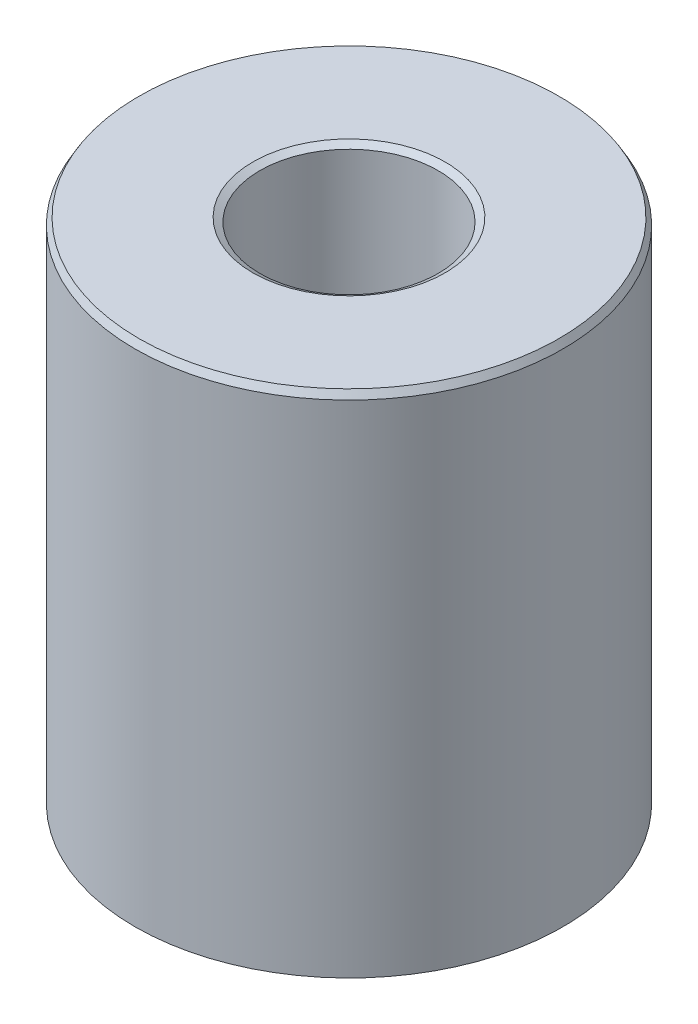
from build123d import *
from OCP.BRepFilletAPI import BRepFilletAPI_MakeChamfer

# Parameters (mm, degrees)
SKETCH1_R           = 42.5
BOSS_EXTRUDE1_DEPTH = 101.568319175
SKETCH2_R           = 17.709257261
CUT_EXTRUDE1_DEPTH  = 119.019589306
CHAMFER1_SIZE       = 1.379298744
CHAMFER1_SIZE2      = 0.796338501


with BuildPart() as part:
    # Sketch1 → Boss-Extrude1 (new body)
    with BuildSketch(Plane(origin=(0, 0, 0), x_dir=(1, 0, 0), z_dir=(0, 1, 0))):
        Circle(SKETCH1_R)
    extrude(amount=BOSS_EXTRUDE1_DEPTH)

    # Sketch2 → Cut-Extrude1 (cut, through all)
    with BuildSketch(Plane(origin=(0, 0, 0), x_dir=(1, 0, 0), z_dir=(0, 1, 0))):
        Circle(SKETCH2_R)
    extrude(amount=CUT_EXTRUDE1_DEPTH, mode=Mode.SUBTRACT)

    # Chamfer1: one chamfer whose edges measure the first distance from different faces: ONE call of the kernel's chamfer builder (chamfer() names one face for all edges)
    chamfer1_edges_1 = [part.edges().sort_by_distance(p)[0] for p in [
        (-17.709257261, 101.568319175, 0),
    ]]
    chamfer1_side_1 = [part.faces().sort_by_distance(p)[0] for p in [
        (-41.297918472, 101.568319175, 0),
    ]]
    chamfer1_edges_2 = [part.edges().sort_by_distance(p)[0] for p in [
        (-17.709257261, 0, 0),
    ]]
    chamfer1_side_2 = [part.faces().sort_by_distance(p)[0] for p in [
        (-17.709257261, 50.784159587, 0),
    ]]
    chamfer1_edges_3 = [part.edges().sort_by_distance(p)[0] for p in [
        (-42.5, 0, 0),
    ]]
    chamfer1_side_3 = [part.faces().sort_by_distance(p)[0] for p in [
        (-41.297918472, 0, 0),
    ]]
    chamfer1_edges_4 = [part.edges().sort_by_distance(p)[0] for p in [
        (-42.5, 101.568319175, 0),
    ]]
    chamfer1_side_4 = [part.faces().sort_by_distance(p)[0] for p in [
        (-42.5, 50.784159587, 0),
    ]]
    chamfer1 = BRepFilletAPI_MakeChamfer(part.part.solid().wrapped)
    for e in chamfer1_edges_1:
        chamfer1.Add(CHAMFER1_SIZE, CHAMFER1_SIZE2, e.wrapped, chamfer1_side_1[0].wrapped)  # the first distance lies on this face
    for e in chamfer1_edges_2:
        chamfer1.Add(CHAMFER1_SIZE, CHAMFER1_SIZE2, e.wrapped, chamfer1_side_2[0].wrapped)  # the first distance lies on this face
    for e in chamfer1_edges_3:
        chamfer1.Add(CHAMFER1_SIZE, CHAMFER1_SIZE2, e.wrapped, chamfer1_side_3[0].wrapped)  # the first distance lies on this face
    for e in chamfer1_edges_4:
        chamfer1.Add(CHAMFER1_SIZE, CHAMFER1_SIZE2, e.wrapped, chamfer1_side_4[0].wrapped)  # the first distance lies on this face
    add(Compound.cast(chamfer1.Shape()), mode=Mode.REPLACE)


solid = part.part
